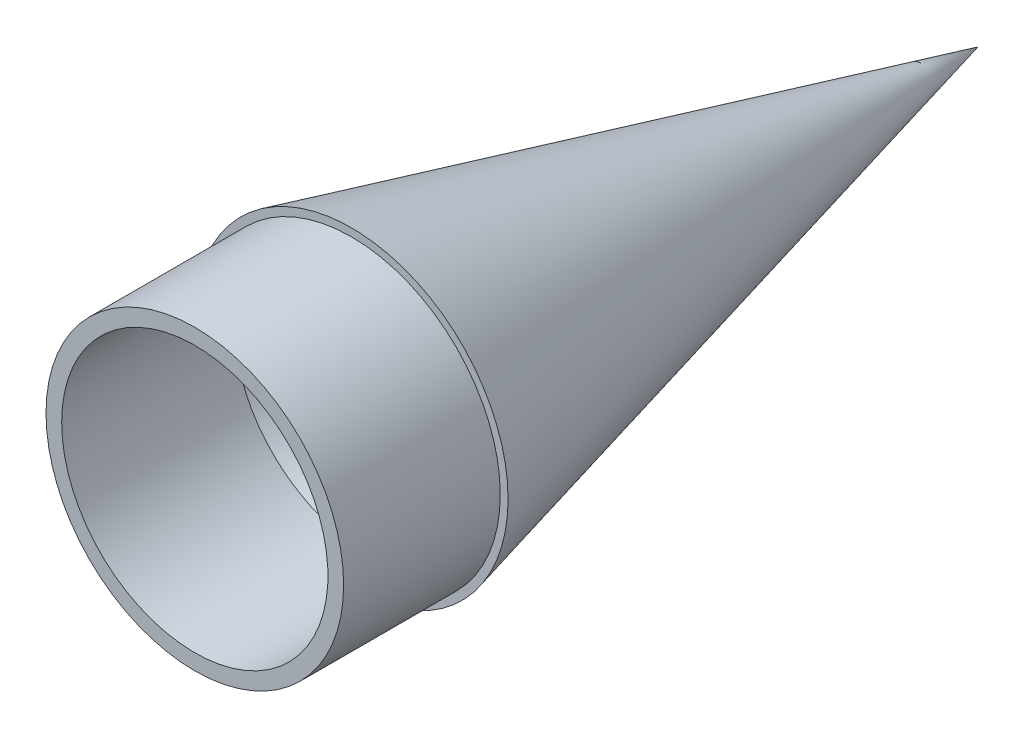
from build123d import *

# Parameters (mm, degrees)
SHELL_1_T = -2


with BuildPart() as part:
    # Эскиз1 → Повернуть1 (revolve)
    with BuildSketch(Plane(origin=(0, 0, 0), x_dir=(1, 0, 0), z_dir=(0, 1, 0))):
        Polygon((0, 80), (-20, 0), (-19, 0), (-19, -20), (-17.743663556, -20), (0, -20), align=None)
    revolve(axis=Axis((0, 0, 20), (0, 0, -1)))

    # Оболочка1
    shell_1_openings = [part.faces().sort_by_distance(p)[0] for p in [
        (0, 0, 20),
    ]]
    offset(amount=SHELL_1_T, openings=shell_1_openings, kind=Kind.INTERSECTION)


solid = part.part
